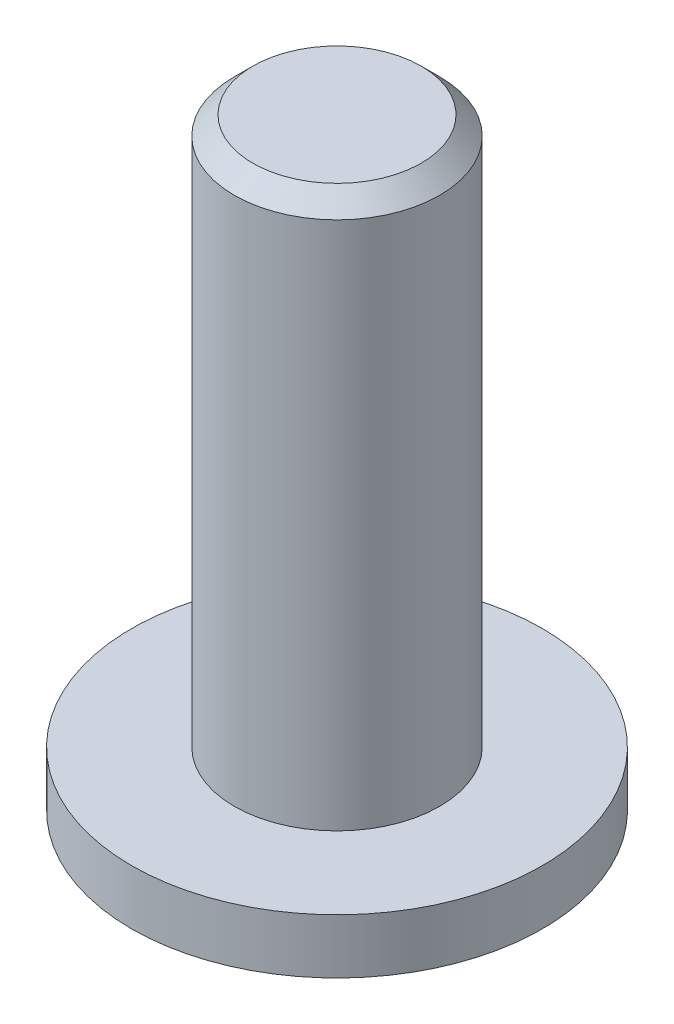
from build123d import *

# Parameters (mm, degrees)
SKETCH_1_R          = 3
EXTRUDE_1_DEPTH     = 0.8
CUT_EXTRUDE_1_DEPTH = 0.5


# Read off the part's stored shape, not the designer's step: M3 机械螺纹 螺柱3
with BuildPart() as part:
    # 草图1 → 凸台-拉伸1 (new body)
    with BuildSketch(Plane(origin=(0, 0, 0), x_dir=(1, 0, 0), z_dir=(0, 1, 0))):
        with Locations(Location((0, 0, 0), (0, 0, 270))):
            Circle(SKETCH_1_R)
    extrude(amount=EXTRUDE_1_DEPTH)

    # M3 机械螺纹 螺柱3 outline → M3 机械螺纹 螺柱3 (revolve)
    with BuildSketch(Plane.XY):
        Polygon((1.2295, 8.8), (0, 8.8), (0, 0.8), (1.5, 0.8), (1.5, 8.5295), align=None)
    revolve(axis=Axis((0, 0, 0), (0, 1, 0)))

    # 草图8 → 切除-拉伸1 (cut)
    with BuildSketch(Plane.XZ):
        Polygon((1.154700538, 0), (0.577350269, 1), (-0.577350269, 1), (-1.154700538, 0), (-0.577350269, -1), (0.577350269, -1), align=None)
    extrude(amount=-CUT_EXTRUDE_1_DEPTH, mode=Mode.SUBTRACT)


solid = part.part
